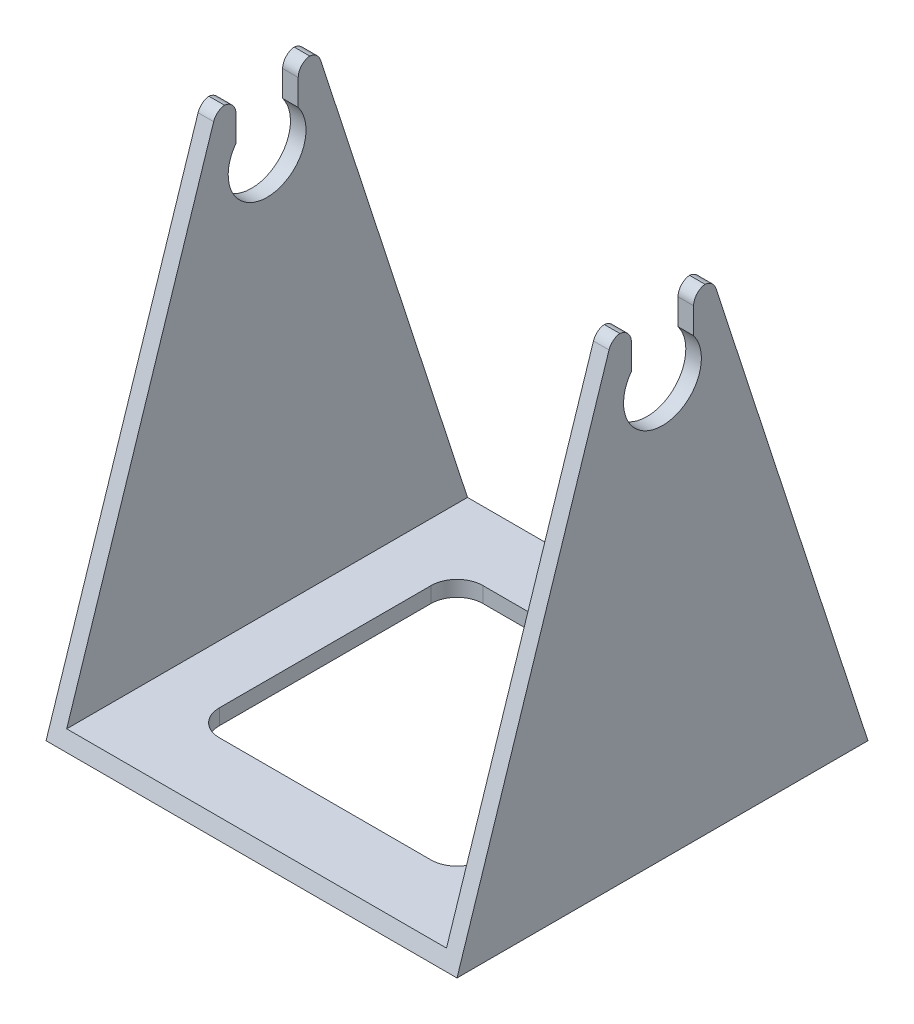
from build123d import *

# Parameters (mm, degrees)
SKETCH1_W           = 79.2
SKETCH1_H           = 79.2
BOSS_EXTRUDE1_DEPTH = 3
CUT_EXTRUDE1_DEPTH  = 3
SKETCH3_W           = 3
SKETCH3_H           = 79.2
BOSS_EXTRUDE2_DEPTH = 88.9
CUT_EXTRUDE2_DEPTH  = 88.9
SKETCH5_R           = 7.5
CUT_EXTRUDE3_DEPTH  = 88.9
SKETCH6_W           = 12
SKETCH6_H           = 15
CUT_EXTRUDE4_DEPTH  = 88.9
FILLET1_R           = 2.5


with BuildPart() as part:
    # Sketch1 → Boss-Extrude1 (new body)
    with BuildSketch(Plane(origin=(0, 0, 0), x_dir=(1, 0, 0), z_dir=(0, 1, 0))):
        Rectangle(SKETCH1_W, SKETCH1_H)
    extrude(amount=BOSS_EXTRUDE1_DEPTH)

    # Sketch2 → Cut-Extrude1 (cut)
    with BuildSketch(Plane(origin=(0, 3, 0), x_dir=(1, 0, 0), z_dir=(0, 1, 0))):
        with BuildLine():
            Line((-20.4, -25.4), (20.4, -25.4))
            ThreePointArc((20.4, -25.4), (23.935533906, -23.935533906), (25.4, -20.4))
            Line((25.4, -20.4), (25.4, 20.4))
            ThreePointArc((25.4, 20.4), (23.935533906, 23.935533906), (20.4, 25.4))
            Line((20.4, 25.4), (-20.4, 25.4))
            ThreePointArc((-20.4, 25.4), (-23.935533906, 23.935533906), (-25.4, 20.4))
            Line((-25.4, 20.4), (-25.4, -20.4))
            ThreePointArc((-25.4, -20.4), (-23.935533906, -23.935533906), (-20.4, -25.4))
        make_face()
    extrude(amount=-CUT_EXTRUDE1_DEPTH, mode=Mode.SUBTRACT)

    # Sketch3 → Boss-Extrude2 (add)
    with BuildSketch(Plane(origin=(0, 3, 0), x_dir=(1, 0, 0), z_dir=(0, 1, 0))):
        with Locations((-38.1, 0)):
            Rectangle(SKETCH3_W, SKETCH3_H)
        with Locations((38.1, 0)):
            Rectangle(SKETCH3_W, SKETCH3_H)
    extrude(amount=BOSS_EXTRUDE2_DEPTH)

    # Sketch4 → Cut-Extrude2 (cut)
    with BuildSketch(Plane(origin=(39.6, 0, 0), x_dir=(0, 0, -1), z_dir=(1, 0, 0))):
        Polygon((-39.6, 0), (-9.739879916, 91.9), (-41.709880552, 102.287682895), (-62.726275387, 13.336826297), align=None)
        Polygon((39.6, 0), (9.739879916, 91.9), (57.349998408, 101.564802913), align=None)
    extrude(amount=-CUT_EXTRUDE2_DEPTH, mode=Mode.SUBTRACT)

    # Sketch5 → Cut-Extrude3 (cut)
    with BuildSketch(Plane(origin=(39.6, 0, 0), x_dir=(0, 0, -1), z_dir=(1, 0, 0))):
        with Locations((0, 79.9)):
            Circle(SKETCH5_R)
    extrude(amount=-CUT_EXTRUDE3_DEPTH, mode=Mode.SUBTRACT)

    # Sketch6 → Cut-Extrude4 (cut)
    with BuildSketch(Plane.ZY.offset(39.6)):
        with Locations((0, 87.4)):
            Rectangle(SKETCH6_W, SKETCH6_H)
    extrude(amount=-CUT_EXTRUDE4_DEPTH, mode=Mode.SUBTRACT)

    # Fillet1
    # the kernel refuses this fillet: 2.5 mm, written as the material it takes off along each edge
    with BuildSketch(Plane(origin=(45.85, 91.9, 6), x_dir=(0, 0, 1), z_dir=(-1, 0, 0)), Plane(origin=(-30.35, 91.9, -6), x_dir=(0, -1, 0), z_dir=(-1, 0, 0))) as fillet1_piece_1:
        with BuildLine():
            CenterArc((FILLET1_R, -FILLET1_R), FILLET1_R, 90, 90)
            Line((0, -FILLET1_R), (0, 0))
            Line((0, 0), (FILLET1_R, 0))
        make_face()
    extrude(amount=15.5, mode=Mode.SUBTRACT)
    with BuildSketch(Plane(origin=(44.1408908, 91.9, 9.739879916), x_dir=(0, 0, -1), z_dir=(-1, 0, 0)), Plane(origin=(-32.0591092, 91.9, 9.739879916), x_dir=(0, 0, -1), z_dir=(-1, 0, 0))) as fillet1_piece_2:
        with BuildLine():
            CenterArc((FILLET1_R * 0.726542528005, FILLET1_R), FILLET1_R, 198, 72)
            Line((-FILLET1_R * 0.22451398829, FILLET1_R * 0.690983005625), (0, 0))
            Line((0, 0), (FILLET1_R * 0.726542528005, 0))
        make_face()
    extrude(amount=12.0817816, mode=Mode.SUBTRACT)
    with BuildSketch(Plane(origin=(30.35, 91.9, -6), x_dir=(0, -1, 0), z_dir=(1, 0, 0)), Plane(origin=(-45.85, 91.9, 6), x_dir=(0, 0, 1), z_dir=(1, 0, 0))) as fillet1_piece_3:
        with BuildLine():
            CenterArc((FILLET1_R, FILLET1_R), FILLET1_R, 180, 90)
            Line((0, FILLET1_R), (0, 0))
            Line((0, 0), (FILLET1_R, 0))
        make_face()
    extrude(amount=15.5, mode=Mode.SUBTRACT)
    with BuildSketch(Plane(origin=(44.1408908, 91.9, -9.739879916), x_dir=(0, 0, 1), z_dir=(-1, 0, 0)), Plane(origin=(-32.0591092, 91.9, -9.739879916), x_dir=(0, 0, 1), z_dir=(-1, 0, 0))) as fillet1_piece_4:
        with BuildLine():
            CenterArc((FILLET1_R * 0.726542528005, -FILLET1_R), FILLET1_R, 90, 72)
            Line((-FILLET1_R * 0.22451398829, -FILLET1_R * 0.690983005625), (0, 0))
            Line((0, 0), (FILLET1_R * 0.726542528005, 0))
        make_face()
    extrude(amount=12.0817816, mode=Mode.SUBTRACT)


solid = part.part
